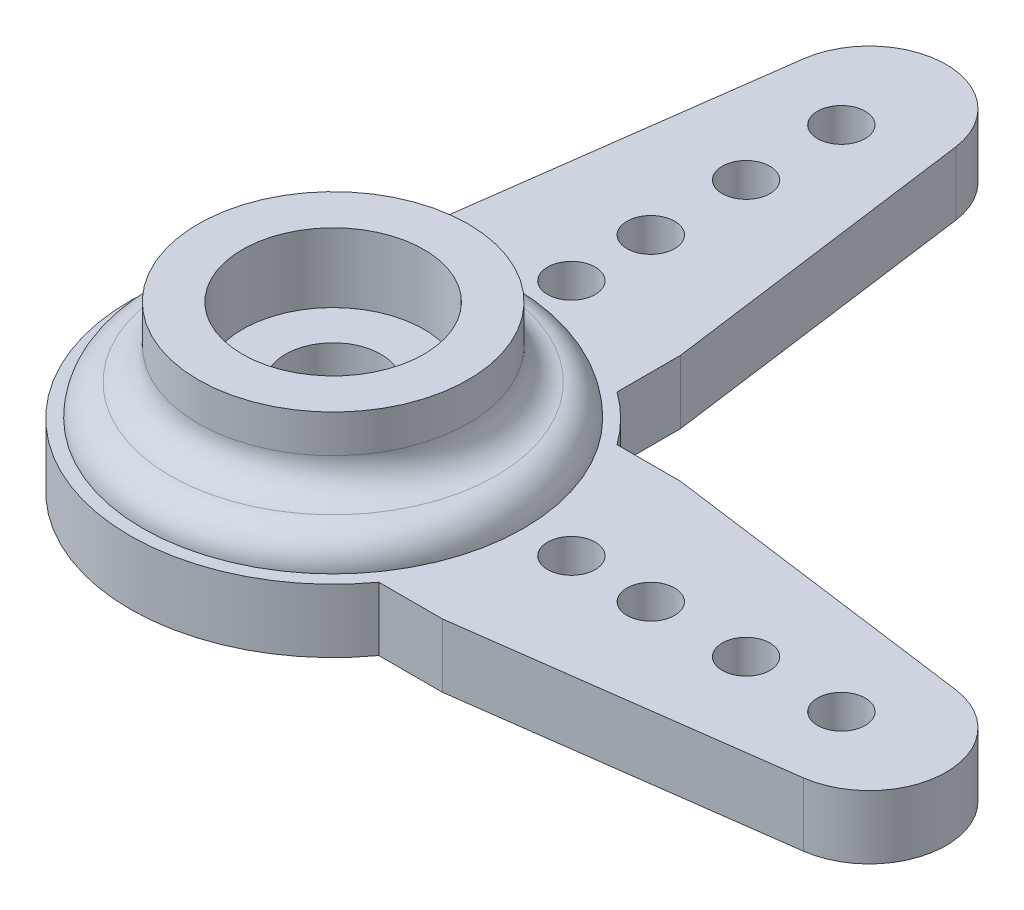
from build123d import *

# Parameters (mm, degrees)
SKETCH1_R           = 1.5
SKETCH1_R_2         = 0.75
BOSS_EXTRUDE1_DEPTH = 2
SKETCH4_R           = 4.25
SKETCH4_R_2         = 2.8575
BOSS_EXTRUDE2_DEPTH = 3.175
SKETCH5_R           = 6
BOSS_EXTRUDE3_DEPTH = 1
FILLET1_R           = 1
FILLET2_R           = 1
SKETCH7_R           = 1.5
CUT_EXTRUDE1_DEPTH  = 28.780580016


with BuildPart() as part:
    # Sketch1 → Boss-Extrude1 (new body)
    with BuildSketch(Plane(origin=(0, 0, 0), x_dir=(1, 0, 0), z_dir=(0, 1, 0))):
        with BuildLine():
            Line((-3.75, 5.186279977), (-3.75, 7.186279977))
            Line((-3.75, 7.186279977), (-2.4, 17.201793966))
            ThreePointArc((-2.4, 17.201793966), (0, 19.3), (2.4, 17.201793966))
            Line((2.4, 17.201793966), (3.75, 7.186279977))
            Line((3.75, 7.186279977), (3.75, 5.186279977))
            ThreePointArc((3.75, 5.186279977), (4.5254834, 4.5254834), (5.186279977, 3.75))
            Line((5.186279977, 3.75), (7.186279977, 3.75))
            Line((7.186279977, 3.75), (17.201793966, 2.4))
            ThreePointArc((17.201793966, 2.4), (19.3, 0), (17.201793966, -2.4))
            Line((17.201793966, -2.4), (7.186279977, -3.75))
            Line((7.186279977, -3.75), (5.186279977, -3.75))
            ThreePointArc((5.186279977, -3.75), (-4.5254834, -4.5254834), (-3.75, 5.186279977))
        make_face()
        with Locations(Location((0, 0, 0), (0, 0, 270))):
            Circle(SKETCH1_R, mode=Mode.SUBTRACT)
        with Locations(Location((0, 16, 0), (0, 0, 270))):
            Circle(SKETCH1_R_2, mode=Mode.SUBTRACT)
        with Locations(Location((0, 13, 0), (0, 0, 270))):
            Circle(SKETCH1_R_2, mode=Mode.SUBTRACT)
        with Locations(Location((0, 10, 0), (0, 0, 270))):
            Circle(SKETCH1_R_2, mode=Mode.SUBTRACT)
        with Locations(Location((0, 7.5, 0), (0, 0, 270))):
            Circle(SKETCH1_R_2, mode=Mode.SUBTRACT)
        with Locations(Location((7.5, 0, 0), (0, 0, 270))):
            Circle(SKETCH1_R_2, mode=Mode.SUBTRACT)
        with Locations(Location((10, 0, 0), (0, 0, 270))):
            Circle(SKETCH1_R_2, mode=Mode.SUBTRACT)
        with Locations(Location((13, 0, 0), (0, 0, 270))):
            Circle(SKETCH1_R_2, mode=Mode.SUBTRACT)
        with Locations(Location((16, 0, 0), (0, 0, 270))):
            Circle(SKETCH1_R_2, mode=Mode.SUBTRACT)
    extrude(amount=BOSS_EXTRUDE1_DEPTH)

    # Sketch4 → Boss-Extrude2 (add)
    with BuildSketch(Plane(origin=(0, 2, 0), x_dir=(1, 0, 0), z_dir=(0, 1, 0))):
        with Locations(Location((0, 0, 0), (0, 0, 270))):
            Circle(SKETCH4_R)
        with Locations(Location((0, 0, 0), (0, 0, 270))):
            Circle(SKETCH4_R_2, mode=Mode.SUBTRACT)
    extrude(amount=BOSS_EXTRUDE2_DEPTH)

    # Sketch5 → Boss-Extrude3 (add)
    with BuildSketch(Plane(origin=(0, 2, 0), x_dir=(1, 0, 0), z_dir=(0, 1, 0))):
        with Locations(Location((0, 0, 0), (0, 0, 270))):
            Circle(SKETCH5_R)
    extrude(amount=BOSS_EXTRUDE3_DEPTH)

    # Fillet1
    fillet1_edges = [part.edges().sort_by_distance(p)[0] for p in [
        (0, 3, -6),
    ]]
    fillet(fillet1_edges, radius=FILLET1_R - 0.0001)  # a hair under: the kernel refuses the full size

    # Fillet2
    fillet2_edges = [part.edges().sort_by_distance(p)[0] for p in [
        (0, 3, -4.25),
    ]]
    fillet(fillet2_edges, radius=FILLET2_R)

    # Sketch7 → Cut-Extrude1 (cut, through all)
    with BuildSketch(Plane.XZ):
        with Locations(Location((0, 0, 0), (0, 0, 90))):
            Circle(SKETCH7_R)
    extrude(amount=-CUT_EXTRUDE1_DEPTH, mode=Mode.SUBTRACT)


solid = part.part
